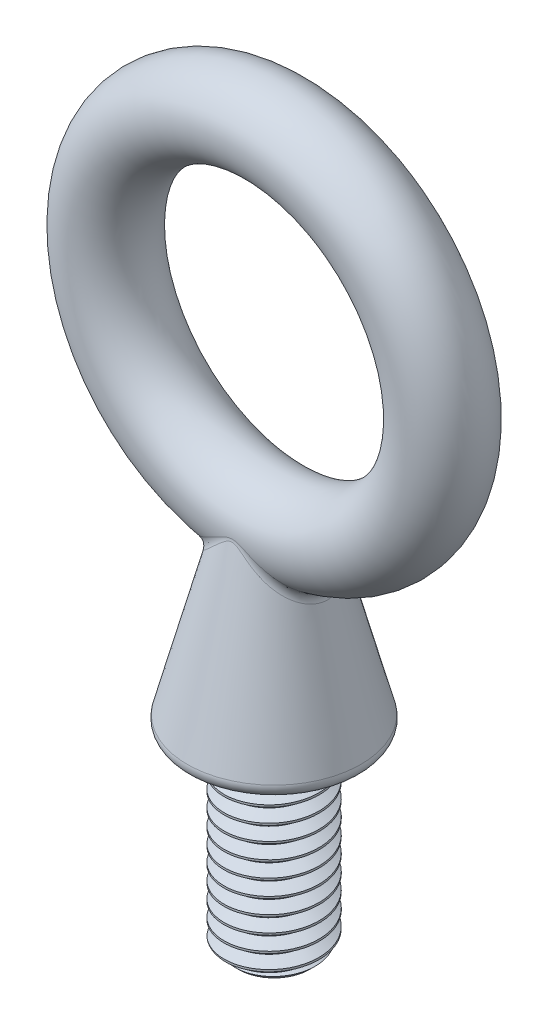
from build123d import *
from build123d.topology import SkipClean

# Parameters (mm, degrees)
BOSS_EXTRUDE1_START = -35.321875
SKETCH2_R           = 4.7625
BOSS_EXTRUDE1_DEPTH = 19.05
CUT_SWEEP1_PITCH    = 1.5875
SKETCH5_OUTSIDE_W   = 58.604
SKETCH5_OUTSIDE_H   = 58.604
SKETCH5_OUTSIDE_R   = 3.559536588
CUT_EXTRUDE1_DEPTH  = 21.205576414
CUT_EXTRUDE1_DRAFT  = -45
SKETCH6_R           = 4.1671875
FILLET1_R           = 1.041796875


with BuildPart() as part:
    # Sketch2 → Boss-Extrude1 (new body)
    with BuildSketch(Plane(origin=(0, 0, 0), x_dir=(1, 0, 0), z_dir=(0, 1, 0)).offset(BOSS_EXTRUDE1_START)):
        with Locations(Location((0, 0, 0), (0, 0, 270))):
            Circle(SKETCH2_R)
    extrude(amount=-BOSS_EXTRUDE1_DEPTH)

    # Cut-Sweep1: the profile of Sketch4 screwed along a right-hand helix of 13 turns, 8 arcs to a turn; built about Z, then put on its axis
    cut_sweep1_z = Axis((0, 0, 0), (0, 0, 1))
    cut_sweep1_corners = [(4.848425958, 0, 0.049609375), (3.731388504, 0, -0.5953125), (3.731388504, 0, -0.79375), (4.848425958, 0, -1.438671875)]
    with BuildLine(mode=Mode.PRIVATE) as cut_sweep1_profile:
        Line(cut_sweep1_corners[0], cut_sweep1_corners[1])
        Line(cut_sweep1_corners[1], cut_sweep1_corners[2])
        Line(cut_sweep1_corners[2], cut_sweep1_corners[3])
        Line(cut_sweep1_corners[3], cut_sweep1_corners[0])
    cut_sweep1_cap = Face(cut_sweep1_profile.wire())
    cut_sweep1_turn_angles = [0, 22.5, 45, 67.5, 90, 112.5, 135, 157.5, 180, 202.5, 225, 247.5, 270, 292.5, 315, 337.5, 360]
    cut_sweep1_turn_weights = [1, 0.9238795325112867, 1, 0.9238795325112867, 1, 0.9238795325112867, 1, 0.9238795325112867, 1, 0.9238795325112867, 1, 0.9238795325112867, 1, 0.9238795325112867, 1, 0.9238795325112867, 1]
    cut_sweep1_turn_rails = [Edge.make_bspline([Vector(p[0], p[1], 0).rotate(cut_sweep1_z, cut_sweep1_turn_angles[k]) / cut_sweep1_turn_weights[k] + Vector(0, 0, p[2] + CUT_SWEEP1_PITCH * cut_sweep1_turn_angles[k] / 360) for k in range(17)], [0, 0, 0, 1, 1, 2, 2, 3, 3, 4, 4, 5, 5, 6, 6, 7, 7, 8, 8, 8], 2, cut_sweep1_turn_weights) for p in cut_sweep1_corners]
    cut_sweep1_turn_sides = [Face.make_surface_from_curves(cut_sweep1_turn_rails[p[0]], cut_sweep1_turn_rails[p[1]]) for p in [(0, 1), (1, 2), (2, 3), (3, 0)]]
    cut_sweep1 = Plane(origin=(0, -54.371875, 0), x_dir=(1, 0, 0), z_dir=(0, 1, 0)) * Solid(Shell([*[p.moved(Location((0, 0, CUT_SWEEP1_PITCH * i))) for i in range(13) for p in cut_sweep1_turn_sides], cut_sweep1_cap, cut_sweep1_cap.rotate(cut_sweep1_z, 4680).moved(Location((0, 0, CUT_SWEEP1_PITCH * 4680 / 360)))]))
    add(cut_sweep1, mode=Mode.SUBTRACT)


with BuildPart() as cut_extrude1_tool:
    # Sketch5 outside → Cut-Extrude1 (with draft: the straight prism first)
    with BuildSketch(Plane.XZ.offset(54.371875)):
        Rectangle(SKETCH5_OUTSIDE_W, SKETCH5_OUTSIDE_H)
        Circle(SKETCH5_OUTSIDE_R, mode=Mode.SUBTRACT)
    extrude(amount=-CUT_EXTRUDE1_DEPTH)
    # Cut-Extrude1: the draft: its side faces are tilted about the plane it starts from
    cut_extrude1_sides = [cut_extrude1_tool.faces().sort_by_distance(p)[0] for p in [
        (0, -43.769086793, -29.302),
        (29.302, -43.769086793, 0),
        (0, -43.769086793, 29.302),
        (-29.302, -43.769086793, 0),
        (-3.559536588, -43.769086793, 0),
    ]]
    draft(cut_extrude1_sides, Plane.XZ.offset(54.371875), CUT_EXTRUDE1_DRAFT)


with BuildPart() as part_1:
    add(part.part)

    # Cut-Extrude1: cut by cut_extrude1_tool
    add(cut_extrude1_tool.part, mode=Mode.SUBTRACT)



with BuildPart() as body_2:
    # Sketch6 → Revolve1 (revolve)
    with BuildSketch(Plane(origin=(0, 0, 0), x_dir=(0, 0, -1), z_dir=(1, 0, 0)), mode=Mode.PRIVATE) as revolve1_sk:
        with Locations((0, 16.8671875)):
            Circle(SKETCH6_R)
    revolve(revolve1_sk.sketch.rotate(Axis((0, 0, -7.63984375), (0, 0, 1)), 90), axis=Axis((0, 0, -7.63984375), (0, 0, 1)))


with BuildPart() as part_2:
    with SkipClean():  # the faces are left unmerged after this step: merging them gives an invalid solid
        add(part_1.part)

        add(body_2.part)  # Revolve2 merges body 2
        # Sketch8 → Revolve2 (revolve)
        with BuildSketch(Plane.XY, mode=Mode.PRIVATE) as revolve2_sk:
            with BuildLine():
                Line((0, -35.321875), (0, -16.8671875))
                Line((0, -16.8671875), (-4.1671875, -16.8671875))
                Line((-4.1671875, -16.8671875), (-8.696699364, -34.014003432))
                ThreePointArc((-8.696699364, -34.014003432), (-8.514842885, -34.915745076), (-7.689453125, -35.321875))
                Line((-7.689453125, -35.321875), (0, -35.321875))
            make_face()
        revolve(revolve2_sk.sketch.rotate(Axis((0, -35.321875, 0), (0, 1, 0)), 270), axis=Axis((0, -35.321875, 0), (0, 1, 0)))

    # Fillet1
    fillet1_edges = [part_2.edges().sort_by_distance(p)[0] for p in [
        (5.102060777, -20.406222273, 1.0424e-05),
    ]]
    fillet(fillet1_edges, radius=FILLET1_R)


solid = part_2.part
